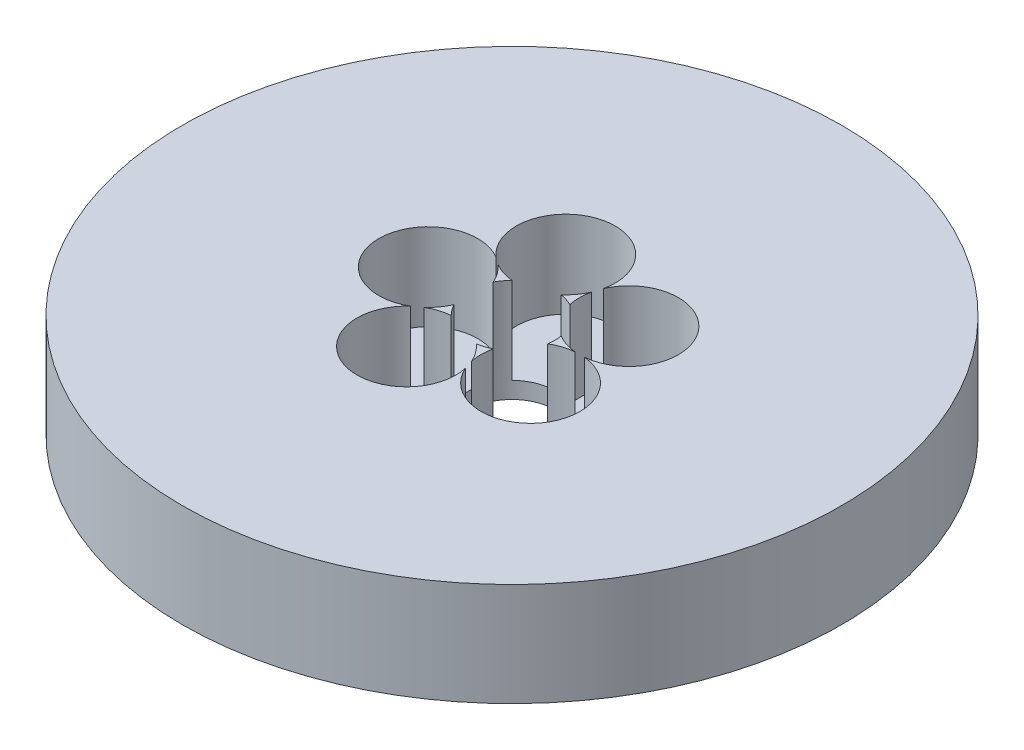
from build123d import *

# Parameters (mm, degrees)
SKETCH1_R           = 57.5
BOSS_EXTRUDE1_DEPTH = 18
SKETCH2_R           = 7.5
CUT_EXTRUDE1_DEPTH  = 84.285653026
SKETCH3_R           = 8.629374231
CUT_EXTRUDE2_DEPTH  = 15.116019146
CIRPATTERN1_COUNT   = 5


with BuildPart() as part:
    # Sketch1 → Boss-Extrude1 (new body)
    with BuildSketch(Plane(origin=(0, 0, 0), x_dir=(1, 0, 0), z_dir=(0, 1, 0))):
        Circle(SKETCH1_R)
    extrude(amount=BOSS_EXTRUDE1_DEPTH)

    # Sketch2 → Cut-Extrude1 (cut, through all)
    with BuildSketch(Plane(origin=(0, 0, 0), x_dir=(1, 0, 0), z_dir=(0, 1, 0))):
        Circle(SKETCH2_R)
    extrude(amount=CUT_EXTRUDE1_DEPTH, mode=Mode.SUBTRACT)

    # Sketch3 → Cut-Extrude2 (cut)
    with BuildSketch(Plane(origin=(0, 18, 0), x_dir=(1, 0, 0), z_dir=(0, 1, 0))):
        with Locations((-14.613023748, 0)):
            Circle(SKETCH3_R)
    cut_extrude2 = extrude(amount=-CUT_EXTRUDE2_DEPTH, mode=Mode.SUBTRACT)

    # CirPattern1: Cut-Extrude2 ×5 about axis
    cirpattern1_axis = Axis((0, 0, 0), (0, 1, 0))
    for i in range(1, CIRPATTERN1_COUNT):
        add(cut_extrude2.rotate(cirpattern1_axis, i * 360 / CIRPATTERN1_COUNT), mode=Mode.SUBTRACT)


solid = part.part
